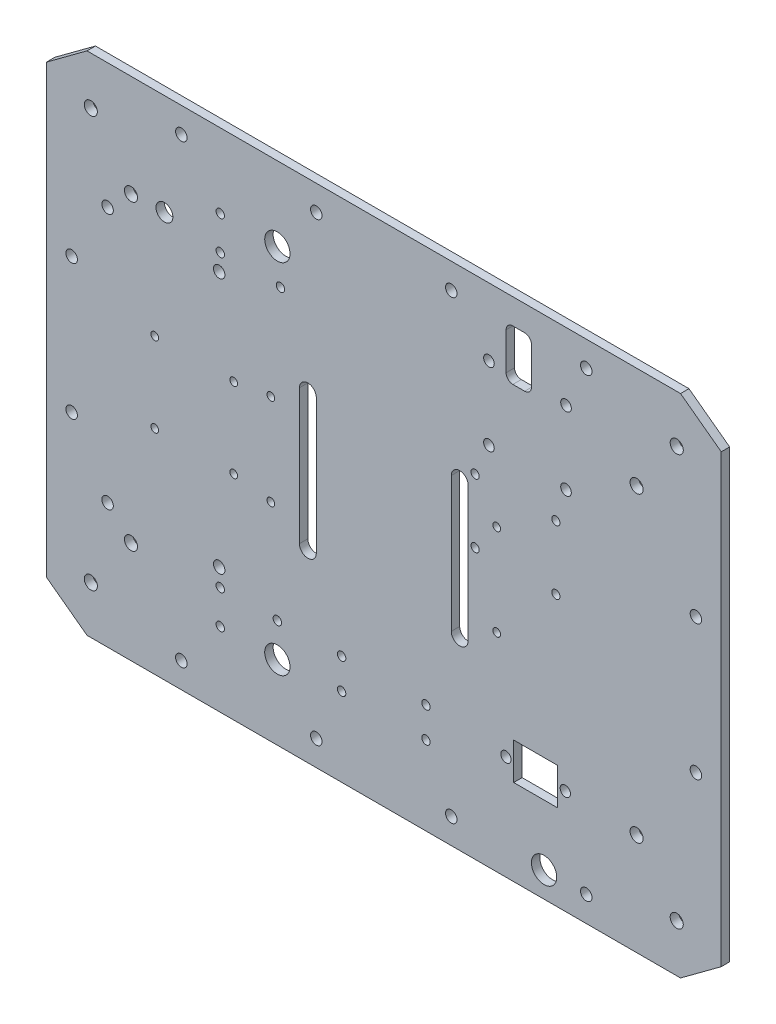
from build123d import *

# Parameters (mm, degrees)
SKETCH1_R                = 2.4638
BOSS_EXTRUDE1_DEPTH      = 3.175
SKETCH2_W                = 16.51
SKETCH2_H                = 13.843
SKETCH2_R                = 1.9431
CUT_EXTRUDE1_DEPTH       = 159.781746826
SKETCH5_R                = 3.175
SKETCH5_R_2              = 2.159
SKETCH5_R_3              = 1.4478
CUT_EXTRUDE2_DEPTH       = 159.781746826
SKETCH6_R                = 2.159
CUT_EXTRUDE3_DEPTH       = 159.781746826
SKETCH5_3_R              = 1.45415
CUT_EXTRUDE4_DEPTH       = 159.781746826
SKETCH5_4_R              = 1.5875
SKETCH5_4_R_2            = 4.7625
CUT_EXTRUDE5_DEPTH       = 159.781746826
SKETCH5_5_R              = 1.5875
CUT_EXTRUDE6_DEPTH       = 2.54
SKETCH5_6_R              = 1.5875
CUT_EXTRUDE7_DEPTH       = 159.781746826
CUT_EXTRUDE8_DEPTH       = 7.62
CUT_EXTRUDE8_DEPTH_BACK  = 2.54
SKETCH5_7_W              = 9.525
SKETCH5_7_H              = 19.05
SKETCH5_7_R              = 1.5875
SKETCH5_9_R              = 1.5875
CUT_EXTRUDE9_DEPTH       = 159.781746826
CUT_EXTRUDE17_DEPTH      = 159.781746826
CUT_EXTRUDE17_DEPTH_BACK = 159.781746826
SKETCH5_15_W             = 9.525
SKETCH5_15_H             = 19.05
FILLET1_R                = 2.54
FILLET2_R                = 2.54
FILLET3_R                = 2.54
FILLET4_R                = 2.54
SKETCH9_R                = 1.55
SKETCH9_R_2              = 2
CUT_EXTRUDE18_DEPTH      = 159.781746826
SKETCH3_R                = 1.5875
CUT_EXTRUDE19_DEPTH      = 976.122


with BuildPart() as part:
    # Sketch1 → Boss-Extrude1 (new body)
    with BuildSketch(Plane.XY):
        Polygon((-111.686526805, -95.25), (-127, -83.918625912), (-127, 83.918625912), (-111.686526805, 95.25), (111.686526805, 95.25), (127, 83.918625912), (127, -83.918625912), (111.686526805, -95.25), align=None)
        with Locations((-95.147512794, 56.885632681)):
            Circle(SKETCH1_R, mode=Mode.SUBTRACT)
        with Locations((-110.256011578, 77.303596941)):
            Circle(SKETCH1_R, mode=Mode.SUBTRACT)
        with Locations((110.256011578, 77.303596941)):
            Circle(SKETCH1_R, mode=Mode.SUBTRACT)
        with Locations((95.147512794, 56.885632681)):
            Circle(SKETCH1_R, mode=Mode.SUBTRACT)
        with Locations((-110.256011578, -77.303596941)):
            Circle(SKETCH1_R, mode=Mode.SUBTRACT)
        with Locations((-95.147512794, -56.885632681)):
            Circle(SKETCH1_R, mode=Mode.SUBTRACT)
        with Locations((110.256011578, -77.303596941)):
            Circle(SKETCH1_R, mode=Mode.SUBTRACT)
        with Locations((95.147512794, -56.885632681)):
            Circle(SKETCH1_R, mode=Mode.SUBTRACT)
    extrude(amount=BOSS_EXTRUDE1_DEPTH)

    # Sketch2 → Cut-Extrude1 (cut, through all)
    with BuildSketch(Plane.XY.offset(3.175)):
        with Locations((57.15, -56.00521613)):
            Rectangle(SKETCH2_W, SKETCH2_H)
        with Locations((68.326, -56.00521613)):
            Circle(SKETCH2_R)
        with Locations((45.974, -56.00521613)):
            Circle(SKETCH2_R)
    extrude(amount=-CUT_EXTRUDE1_DEPTH, mode=Mode.SUBTRACT)

    # Sketch5 → Cut-Extrude2 (cut, through all)
    with BuildSketch(Plane(origin=(0, 0, 0), x_dir=(-1, 0, 0), z_dir=(0, 0, -1))):
        with Locations((82.55, 57.21604)):
            Circle(SKETCH5_R)
        with Locations((61.9506, -48.13554)):
            Circle(SKETCH5_R_2)
        with Locations((103.9495, -48.13554)):
            Circle(SKETCH5_R_2)
        with Locations((103.9495, 48.13554)):
            Circle(SKETCH5_R_2)
        with Locations((61.9506, 48.13554)):
            Circle(SKETCH5_R_2)
        with BuildLine():
            Line((-31.75, 25.4), (-31.75, -25.4))
            ThreePointArc((-31.75, -25.4), (-28.575, -28.575), (-25.4, -25.4))
            Line((-25.4, -25.4), (-25.4, 25.4))
            ThreePointArc((-25.4, 25.4), (-28.575, 28.575), (-31.75, 25.4))
        make_face()
        with Locations((86.197426463, 15.03413)):
            Circle(SKETCH5_R_3)
        with Locations((56.479426463, 15.03413)):
            Circle(SKETCH5_R_3)
        with Locations((56.479426463, -15.03413)):
            Circle(SKETCH5_R_3)
        with Locations((86.197426463, -15.03413)):
            Circle(SKETCH5_R_3)
        with BuildLine():
            ThreePointArc((31.75, 25.4), (28.575, 28.575), (25.4, 25.4))
            Line((25.4, 25.4), (25.4, -25.4))
            ThreePointArc((25.4, -25.4), (28.575, -28.575), (31.75, -25.4))
            Line((31.75, -25.4), (31.75, 25.4))
        make_face()
    extrude(amount=-CUT_EXTRUDE2_DEPTH, mode=Mode.SUBTRACT)

    # Sketch6 → Cut-Extrude3 (cut, through all)
    with BuildSketch(Plane(origin=(0, 0, 0), x_dir=(-1, 0, 0), z_dir=(0, 0, -1))):
        with Locations((-76.2, -85.725)):
            Circle(SKETCH6_R)
        with Locations((-25.4, -85.725)):
            Circle(SKETCH6_R)
        with Locations((25.4, -85.725)):
            Circle(SKETCH6_R)
        with Locations((76.2, -85.725)):
            Circle(SKETCH6_R)
        with Locations((76.2, 85.725)):
            Circle(SKETCH6_R)
        with Locations((25.4, 85.725)):
            Circle(SKETCH6_R)
        with Locations((-25.4, 85.725)):
            Circle(SKETCH6_R)
        with Locations((-76.2, 85.725)):
            Circle(SKETCH6_R)
        with Locations((117.475, -25.4)):
            Circle(SKETCH6_R)
        with Locations((117.475, 25.4)):
            Circle(SKETCH6_R)
        with Locations((-117.475, 25.4)):
            Circle(SKETCH6_R)
        with Locations((-117.475, -25.4)):
            Circle(SKETCH6_R)
    extrude(amount=-CUT_EXTRUDE3_DEPTH, mode=Mode.SUBTRACT)

    # Sketch5<3> → Cut-Extrude4 (cut, through all)
    with BuildSketch(Plane(origin=(0, 0, 0), x_dir=(-1, 0, 0), z_dir=(0, 0, -1))):
        with Locations((-42.5, 17.2)):
            Circle(SKETCH5_3_R)
        with Locations((-42.5, -17.2)):
            Circle(SKETCH5_3_R)
        with Locations((42.5, -17.2)):
            Circle(SKETCH5_3_R)
        with Locations((42.5, 17.2)):
            Circle(SKETCH5_3_R)
    extrude(amount=-CUT_EXTRUDE4_DEPTH, mode=Mode.SUBTRACT)

    # Sketch5<4> → Cut-Extrude5 (cut, through all)
    with BuildSketch(Plane(origin=(0, 0, 0), x_dir=(-1, 0, 0), z_dir=(0, 0, -1))):
        with Locations((61.544630637, -54.61)):
            Circle(SKETCH5_4_R)
        with Locations((61.544630637, -67.31)):
            Circle(SKETCH5_4_R)
        with Locations((-60.325, -85.725)):
            Circle(SKETCH5_4_R_2)
        with Locations((61.544630637, 54.61)):
            Circle(SKETCH5_4_R)
        with Locations((40.055369363, -67.31)):
            Circle(SKETCH5_4_R_2)
        with Locations((61.544630637, 67.31)):
            Circle(SKETCH5_4_R)
        with Locations((40.055369363, 67.31)):
            Circle(SKETCH5_4_R_2)
    extrude(amount=-CUT_EXTRUDE5_DEPTH, mode=Mode.SUBTRACT)

    # Sketch5<5> → Cut-Extrude6 (cut)
    with BuildSketch(Plane(origin=(0, 0, 0), x_dir=(-1, 0, 0), z_dir=(0, 0, -1))):
        with Locations((38.886108088, 54.61)):
            Circle(SKETCH5_5_R)
    extrude(amount=-CUT_EXTRUDE6_DEPTH, mode=Mode.SUBTRACT)

    # Sketch5<6> → Cut-Extrude7 (cut, through all)
    with BuildSketch(Plane(origin=(0, 0, 0), x_dir=(-1, 0, 0), z_dir=(0, 0, -1))):
        with Locations((38.886108088, 54.61)):
            Circle(SKETCH5_6_R)
    extrude(amount=-CUT_EXTRUDE7_DEPTH, mode=Mode.SUBTRACT)

    # Sketch5<7> → Cut-Extrude8 (cut, two sides: drawn at the far end of the back side and taken through both)
    with BuildSketch(Plane(origin=(0, 0, 0), x_dir=(-1, 0, 0), z_dir=(0, 0, -1)).offset(-CUT_EXTRUDE8_DEPTH_BACK)):
        with Locations((-50.8, 76.2)):
            Rectangle(SKETCH5_7_W, SKETCH5_7_H)
        with Locations((40.055369363, -54.61)):
            Circle(SKETCH5_7_R)
    extrude(amount=CUT_EXTRUDE8_DEPTH + CUT_EXTRUDE8_DEPTH_BACK, mode=Mode.SUBTRACT)

    # Sketch5<9> → Cut-Extrude9 (cut, through all)
    with BuildSketch(Plane(origin=(0, 0, 0), x_dir=(-1, 0, 0), z_dir=(0, 0, -1))):
        with Locations((40.055369363, -54.61)):
            Circle(SKETCH5_9_R)
    extrude(amount=-CUT_EXTRUDE9_DEPTH, mode=Mode.SUBTRACT)

    # Sketch5<15> → Cut-Extrude17 (cut, two sides: drawn at the far end of the back side and taken through both)
    with BuildSketch(Plane(origin=(0, 0, 0), x_dir=(-1, 0, 0), z_dir=(0, 0, -1)).offset(-CUT_EXTRUDE17_DEPTH_BACK)):
        with Locations((-50.8, 76.2)):
            Rectangle(SKETCH5_15_W, SKETCH5_15_H)
    extrude(amount=CUT_EXTRUDE17_DEPTH + CUT_EXTRUDE17_DEPTH_BACK, mode=Mode.SUBTRACT)

    # Fillet1
    fillet1_edges = [part.edges().sort_by_distance(p)[0] for p in [
        (55.5625, 85.725, 1.5875),
    ]]
    fillet(fillet1_edges, radius=FILLET1_R)

    # Fillet2
    fillet2_edges = [part.edges().sort_by_distance(p)[0] for p in [
        (46.0375, 85.725, 1.5875),
    ]]
    fillet(fillet2_edges, radius=FILLET2_R)

    # Fillet3
    fillet3_edges = [part.edges().sort_by_distance(p)[0] for p in [
        (46.0375, 66.675, 1.5875),
    ]]
    fillet(fillet3_edges, radius=FILLET3_R)

    # Fillet4
    fillet4_edges = [part.edges().sort_by_distance(p)[0] for p in [
        (55.5625, 66.675, 1.5875),
    ]]
    fillet(fillet4_edges, radius=FILLET4_R)

    # Sketch9 → Cut-Extrude18 (cut, through all)
    with BuildSketch(Plane.XY.offset(3.175)):
        with Locations((34.370000094, 30.350000006)):
            Circle(SKETCH9_R)
        with Locations((64.77, 30.350000006)):
            Circle(SKETCH9_R)
        with Locations((64.77, 6.35)):
            Circle(SKETCH9_R)
        with Locations((34.370000094, 6.35)):
            Circle(SKETCH9_R)
        with Locations((68.58, 69.85)):
            Circle(SKETCH9_R_2)
        with Locations((39.58, 69.85)):
            Circle(SKETCH9_R_2)
        with Locations((39.58, 42.35)):
            Circle(SKETCH9_R_2)
        with Locations((68.58, 42.35)):
            Circle(SKETCH9_R_2)
    extrude(amount=-CUT_EXTRUDE18_DEPTH, mode=Mode.SUBTRACT)

    # Sketch3 → Cut-Extrude19 (cut)
    with BuildSketch(Plane.XY.offset(3.175)):
        with Locations((-15.875, -65.560310834)):
            Circle(SKETCH3_R)
        with Locations((15.875, -65.560310834)):
            Circle(SKETCH3_R)
        with Locations((-15.875, -54.130310834)):
            Circle(SKETCH3_R)
        with Locations((15.875, -54.130310834)):
            Circle(SKETCH3_R)
    extrude(amount=-CUT_EXTRUDE19_DEPTH, mode=Mode.SUBTRACT)


solid = part.part
